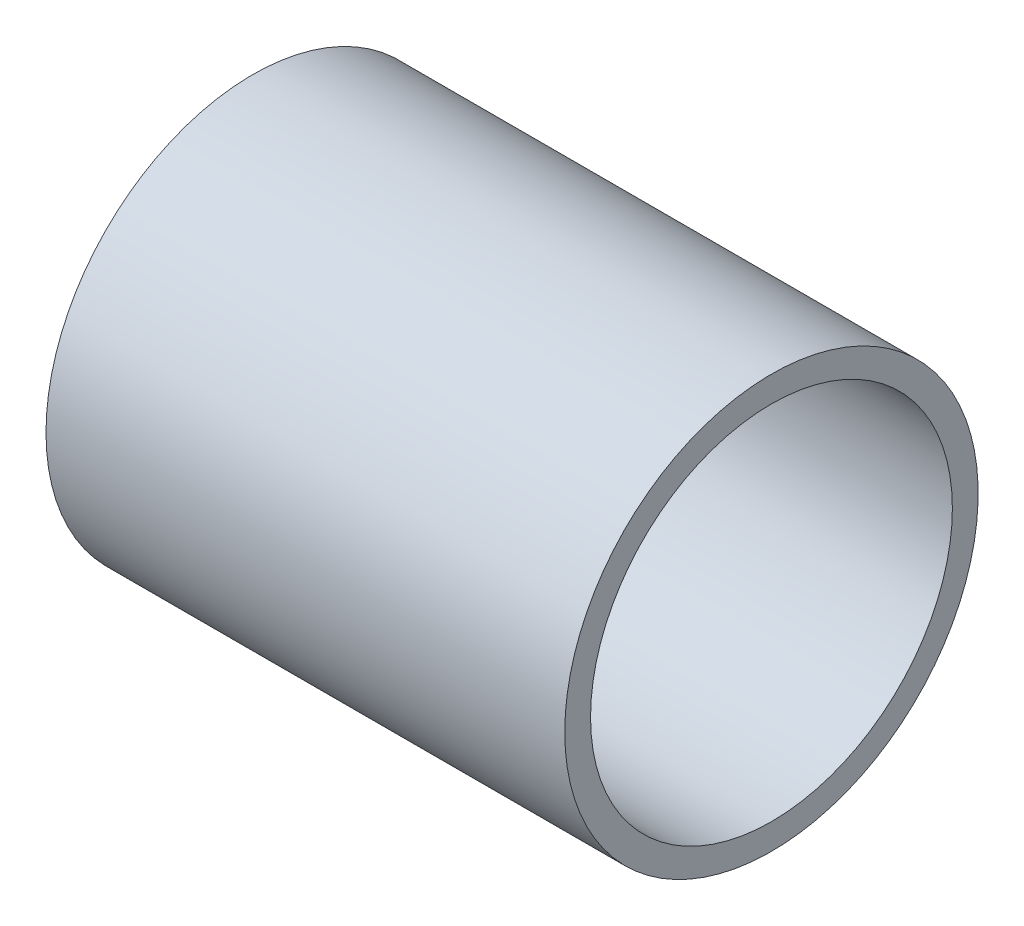
from build123d import *

# Parameters (mm, degrees)
SKETCH2_W = 406.4
SKETCH2_H = 20.193


with BuildPart() as part:
    # Sketch2 → Revolve1 (revolve)
    with BuildSketch(Plane.XY):
        with Locations((203.2, 151.8285)):
            Rectangle(SKETCH2_W, SKETCH2_H)
    revolve(axis=Axis((0, 0, 0), (1, 0, 0)))


solid = part.part
